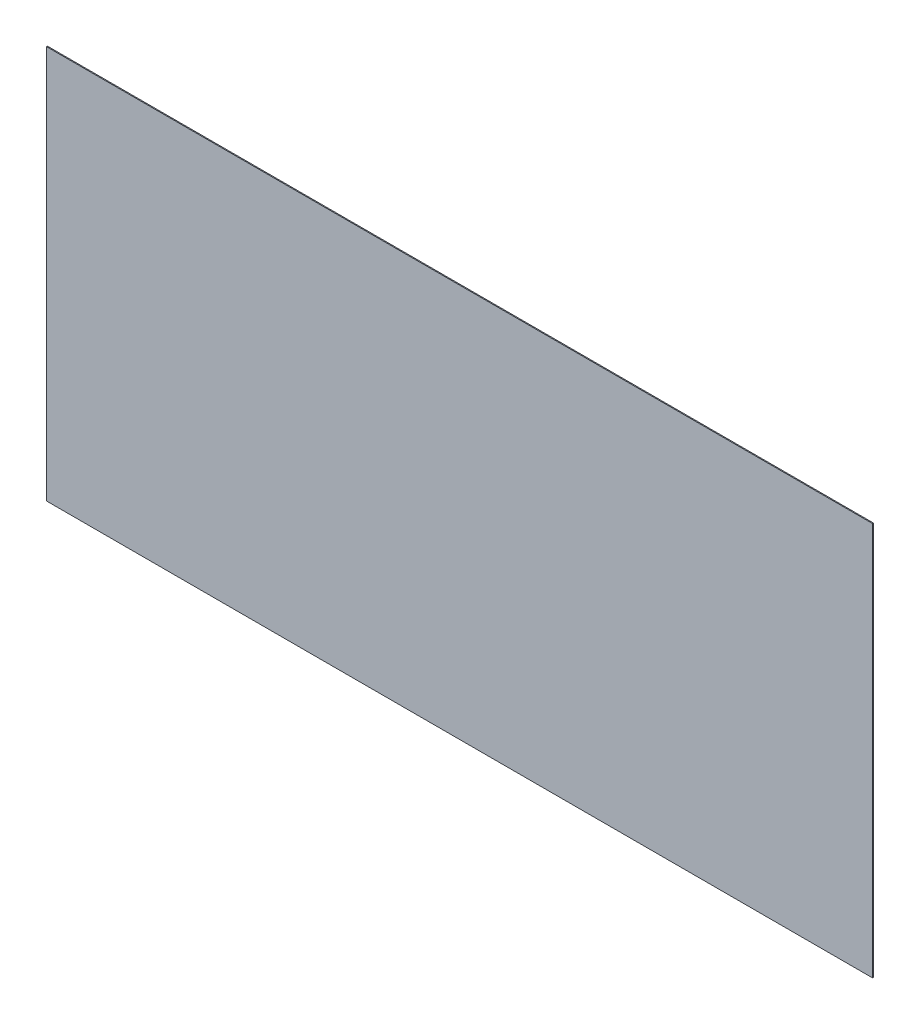
from build123d import *

# Parameters (mm, degrees)
SZKIC1_W                    = 1050
SZKIC1_H                    = 500
DODANIE_WYCI_GNI_CIE1_DEPTH = 1.2


with BuildPart() as part:
    # Szkic1 → Dodanie-wyciągnięcie1 (new body)
    with BuildSketch(Plane(origin=(0, 0, 258.40163706), x_dir=(-1, 0, 0), z_dir=(0, 0, -1))):
        with Locations((-13.306408848, 1069.897330633)):
            Rectangle(SZKIC1_W, SZKIC1_H)
    extrude(amount=DODANIE_WYCI_GNI_CIE1_DEPTH)


solid = part.part
